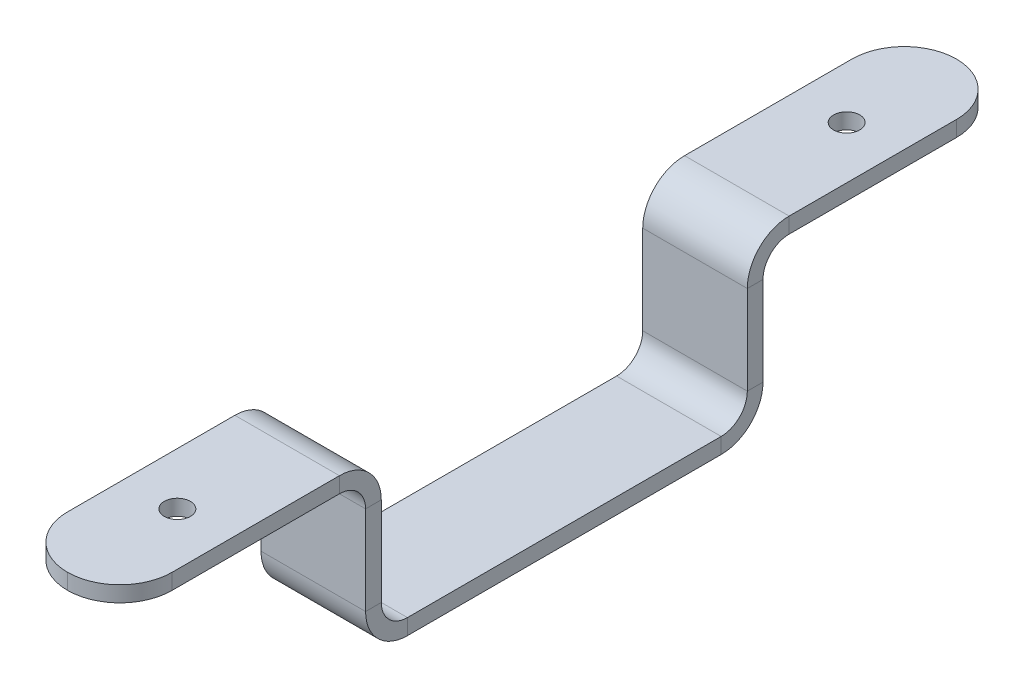
from build123d import *

# Parameters (mm, degrees)
BASE_FLANGE1_DEPTH = 20
SKETCH6_R          = 2.5
CUT_EXTRUDE1_DEPTH = 10
FILLET1_R          = 10


# Sheet-metal steps are written as plain solids
with BuildPart() as part:
    # Sketch1 → Base-Flange1 (new body)
    with BuildSketch(Plane(origin=(0, 0, 0), x_dir=(0, 0, -1), z_dir=(1, 0, 0))):
        with BuildLine():
            Line((-85, 0), (-43, 0))
            ThreePointArc((-43, 0), (-37.343145751, -2.343145751), (-35, -8))
            Line((-35, -8), (-35, -25))
            ThreePointArc((-35, -25), (-33.535533906, -28.535533906), (-30, -30))
            Line((-30, -30), (30, -30))
            ThreePointArc((30, -30), (33.535533906, -28.535533906), (35, -25))
            Line((35, -25), (35, -8))
            ThreePointArc((35, -8), (37.343145751, -2.343145751), (43, 0))
            Line((43, 0), (85, 0))
            Line((85, 0), (85, -3))
            Line((85, -3), (43, -3))
            ThreePointArc((43, -3), (39.464466094, -4.464466094), (38, -8))
            Line((38, -8), (38, -25))
            ThreePointArc((38, -25), (35.656854249, -30.656854249), (30, -33))
            Line((30, -33), (-30, -33))
            ThreePointArc((-30, -33), (-35.656854249, -30.656854249), (-38, -25))
            Line((-38, -25), (-38, -8))
            ThreePointArc((-38, -8), (-39.464466094, -4.464466094), (-43, -3))
            Line((-43, -3), (-85, -3))
            Line((-85, -3), (-85, 0))
        make_face()
    extrude(amount=BASE_FLANGE1_DEPTH)

    # Sketch6 → Cut-Extrude1 (cut)
    with BuildSketch(Plane(origin=(0, 0, 0), x_dir=(1, 0, 0), z_dir=(0, 1, 0))):
        with Locations(Location((10, 64, 0), (0, 0, 270))):
            Circle(SKETCH6_R)
        with Locations(Location((10, -64, 0), (0, 0, 90))):
            Circle(SKETCH6_R)
    extrude(amount=-CUT_EXTRUDE1_DEPTH, mode=Mode.SUBTRACT)

    # Fillet1
    fillet1_edges = [part.edges().sort_by_distance(p)[0] for p in [
        (20, -1.5, -85),
        (0, -1.5, -85),
        (0, -1.5, 85),
        (20, -1.5, 85),
    ]]
    fillet(fillet1_edges, radius=FILLET1_R - 0.0001)  # a hair under: the kernel refuses the full size


solid = part.part
